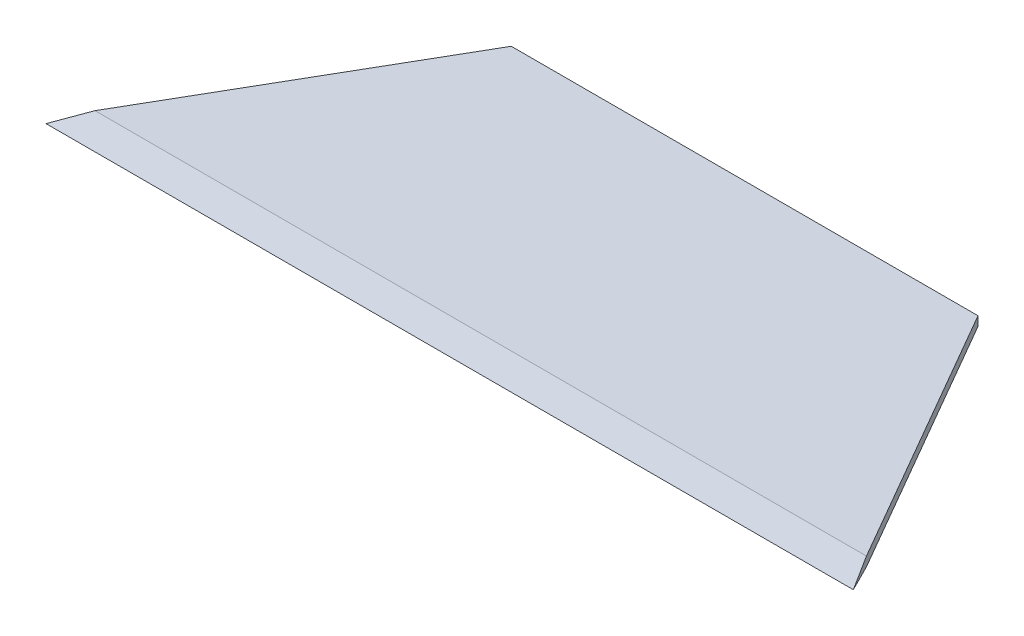
from build123d import *

# Parameters (mm, degrees)
BOSS_EXTRUDE1_DEPTH = 0.6
CHAMFER1_SIZE       = 0.3
CHAMFER1_SIZE2      = 2
CHAMFER2_SIZE       = 0.3
CHAMFER2_SIZE_2     = 2


with BuildPart() as part:
    # Sketch1 → Boss-Extrude1 (new body)
    with BuildSketch(Plane(origin=(0, 0, 0), x_dir=(1, 0, 0), z_dir=(0, 1, 0))):
        Polygon((-15.030344885, 9.5), (15.030344885, 9.5), (26, -9.5), (-26, -9.5), align=None)
    extrude(amount=BOSS_EXTRUDE1_DEPTH)

    # Chamfer1
    chamfer1_edges = [part.edges().sort_by_distance(p)[0] for p in [
        (0, 0.6, 9.5),
    ]]
    chamfer1_side = [part.faces().sort_by_distance(p)[0] for p in [
        (0, 0.3, 9.5),
    ]]
    chamfer(chamfer1_edges, length=CHAMFER1_SIZE, length2=CHAMFER1_SIZE2, reference=chamfer1_side[0])

    # Chamfer2
    # the kernel refuses this chamfer: 2, 0.3 mm, written as the material it takes off along each edge
    with BuildSketch(Plane(origin=(31.19787194, 0, 9.5), x_dir=(0, 0.9692970769593504, 0.24589261192247985), z_dir=(-1, 0, 0))) as chamfer2_piece_1:
        Polygon((CHAMFER2_SIZE * 0.969297076959, CHAMFER2_SIZE * 0.245892611922), (-CHAMFER2_SIZE_2 * 0.245892611922, CHAMFER2_SIZE_2 * 0.969297076959), (0, 0), align=None)
    extrude(amount=62.39574388, mode=Mode.SUBTRACT)


solid = part.part
